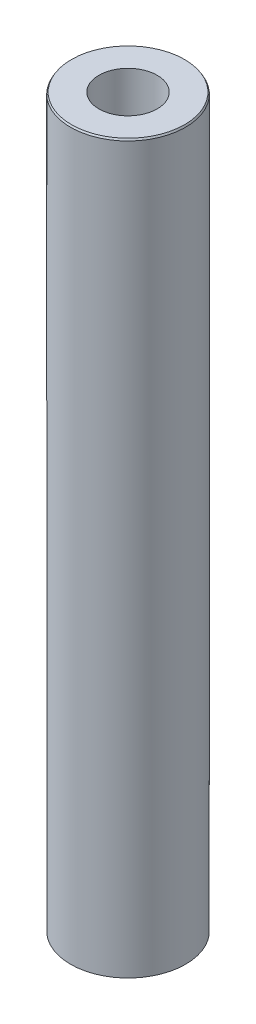
from build123d import *
from OCP.BRepFilletAPI import BRepFilletAPI_MakeChamfer

# Parameters (mm, degrees)
SKETCH1_R           = 7.5
BOSS_EXTRUDE1_DEPTH = 94.870552572
SKETCH2_R           = 3.80207815
CUT_EXTRUDE1_DEPTH  = 96.461624464
CHAMFER1_SIZE       = 0.22361257
CHAMFER1_SIZE2      = 0.129102778


with BuildPart() as part:
    # Sketch1 → Boss-Extrude1 (new body)
    with BuildSketch(Plane(origin=(0, 0, 0), x_dir=(1, 0, 0), z_dir=(0, 1, 0))):
        Circle(SKETCH1_R)
    extrude(amount=BOSS_EXTRUDE1_DEPTH)

    # Sketch2 → Cut-Extrude1 (cut, through all)
    with BuildSketch(Plane(origin=(0, 0, 0), x_dir=(1, 0, 0), z_dir=(0, 1, 0))):
        Circle(SKETCH2_R)
    extrude(amount=CUT_EXTRUDE1_DEPTH, mode=Mode.SUBTRACT)

    # Chamfer1: one chamfer whose edges measure the first distance from different faces: ONE call of the kernel's chamfer builder (chamfer() names one face for all edges)
    chamfer1_edges_1 = [part.edges().sort_by_distance(p)[0] for p in [
        (-7.5, 94.870552572, 0),
    ]]
    chamfer1_side_1 = [part.faces().sort_by_distance(p)[0] for p in [
        (-7.5, 47.435276286, 0),
    ]]
    chamfer1_edges_2 = [part.edges().sort_by_distance(p)[0] for p in [
        (-7.5, 0, 0),
    ]]
    chamfer1_side_2 = [part.faces().sort_by_distance(p)[0] for p in [
        (-7.287867966, 0, 0),
    ]]
    chamfer1 = BRepFilletAPI_MakeChamfer(part.part.solid().wrapped)
    for e in chamfer1_edges_1:
        chamfer1.Add(CHAMFER1_SIZE, CHAMFER1_SIZE2, e.wrapped, chamfer1_side_1[0].wrapped)  # the first distance lies on this face
    for e in chamfer1_edges_2:
        chamfer1.Add(CHAMFER1_SIZE, CHAMFER1_SIZE2, e.wrapped, chamfer1_side_2[0].wrapped)  # the first distance lies on this face
    add(Compound.cast(chamfer1.Shape()), mode=Mode.REPLACE)


solid = part.part
